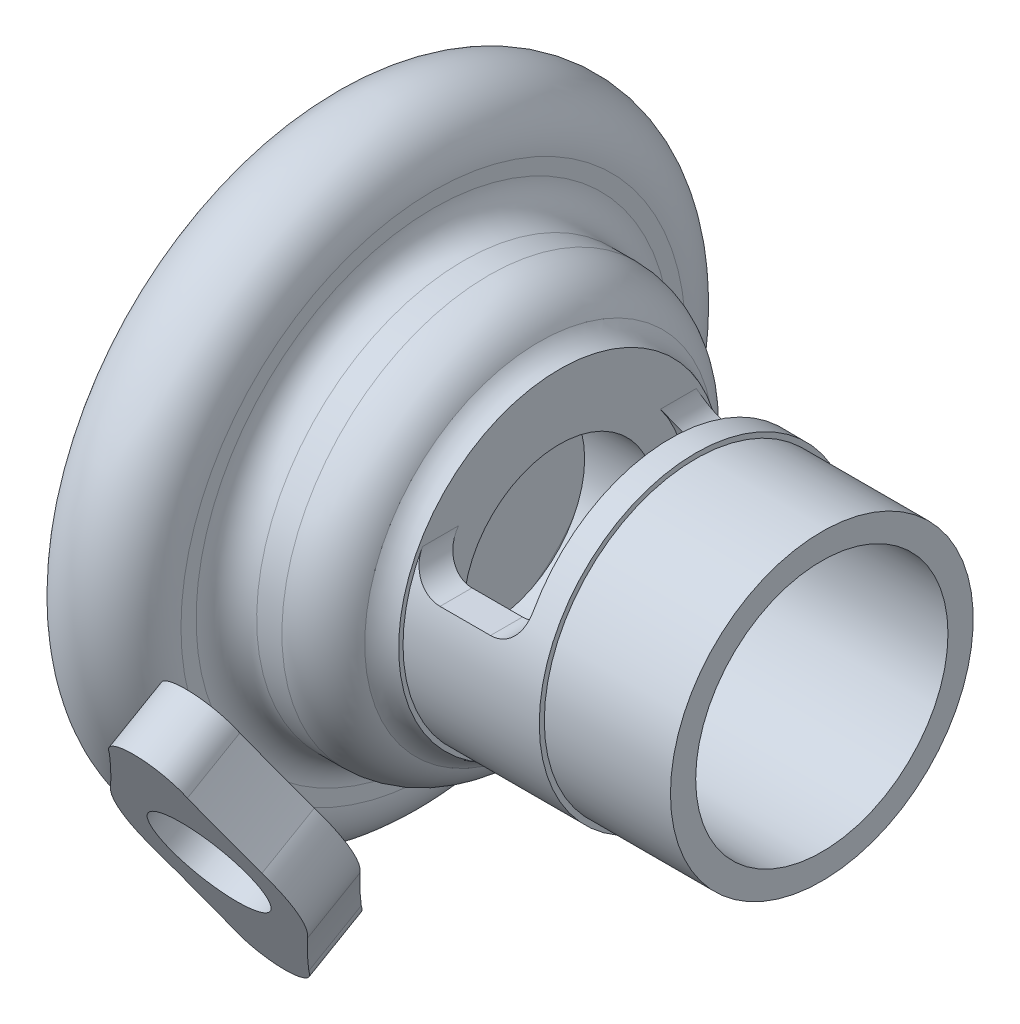
from build123d import *

# Parameters (mm, degrees)
SKETCH3_R               = 31
SKETCH3_R_2             = 25
BOSS_EXTRUDE1_DEPTH     = 22
CUT_EXTRUDE1_DEPTH      = 66.749524713
CUT_EXTRUDE1_DEPTH_BACK = 66.749524713
SKETCH12_R              = 11
BOSS_EXTRUDE2_DEPTH     = 12
CUT_EXTRUDE2_REACH      = 108.699
SKETCH15_R              = 6


with BuildPart() as part:
    # Sketch1 → Revolve1 (revolve)
    with BuildSketch(Plane.XY):
        Polygon((49, 25), (19, 25), (19, 31), (24, 31), (24, 30), (49, 30), align=None)
    revolve(axis=Axis((-49, 0, 0), (1, 0, 0)))

    # Sketch3 → Boss-Extrude1 (add)
    with BuildSketch(Plane.ZY.offset(-19)):
        Circle(SKETCH3_R)
        Circle(SKETCH3_R_2, mode=Mode.SUBTRACT)
    extrude(amount=BOSS_EXTRUDE1_DEPTH)

    # Sketch4 → Cut-Extrude1 (cut, two sides: drawn at the far end of the back side and taken through both)
    with BuildSketch(Plane.XY.offset(-CUT_EXTRUDE1_DEPTH_BACK)):
        with BuildLine():
            Line((-3, 31), (19, 31))
            Line((19, 31), (19, 15))
            ThreePointArc((19, 15), (17.242640687, 10.757359313), (13, 9))
            Line((13, 9), (3, 9))
            ThreePointArc((3, 9), (-1.242640687, 10.757359313), (-3, 15))
            Line((-3, 15), (-3, 31))
        make_face()
    extrude(amount=CUT_EXTRUDE1_DEPTH + CUT_EXTRUDE1_DEPTH_BACK, mode=Mode.SUBTRACT)

    # Sketch10 → Revolve2 (revolve)
    with BuildSketch(Plane.XY):
        with BuildLine():
            Line((-3, 19), (-3, 31.867711866))
            ThreePointArc((-3, 31.867711866), (-5.24492632, 32.866535949), (-7.001114883, 34.585007788))
            ThreePointArc((-7.001114883, 34.585007788), (-19.346514832, 40.746807346), (-28, 30))
            Line((-28, 30), (-28, 0))
            Line((-28, 0), (-25, 0))
            Line((-25, 0), (-25, 30))
            ThreePointArc((-25, 30), (-11.343145751, 35.656854249), (-17, 22))
            Line((-17, 22), (-17, 19))
            Line((-17, 19), (-3, 19))
        make_face()
    revolve(axis=Axis((49, 0, 0), (-1, 0, 0)))



with BuildPart() as body_2:
    # Sketch12 → Boss-Extrude2 (new body)
    with BuildSketch(Plane(origin=(0, -32, 55.425625842), x_dir=(1, 0, 0), z_dir=(0, -0.5000000000000013, 0.8660254037844379))):
        with BuildLine():
            ThreePointArc((-9.270893516, 24.064197899), (-17, 30), (-24.729106484, 24.064197899))
            ThreePointArc((-24.729106484, 24.064197899), (-28.24985512, 16.494307295), (-31.990055384, 9.030406391))
            ThreePointArc((-31.990055384, 9.030406391), (-34.5, 0), (-31.990055384, -9.030406391))
            ThreePointArc((-31.990055384, -9.030406391), (-28.24985512, -16.494307295), (-24.729106484, -24.064197899))
            ThreePointArc((-24.729106484, -24.064197899), (-17, -30), (-9.270893516, -24.064197899))
            ThreePointArc((-9.270893516, -24.064197899), (-5.75014488, -16.494307295), (-2.009944616, -9.030406391))
            ThreePointArc((-2.009944616, -9.030406391), (0.5, 0), (-2.009944616, 9.030406391))
            ThreePointArc((-2.009944616, 9.030406391), (-5.75014488, 16.494307295), (-9.270893516, 24.064197899))
        make_face()
        with Locations((-17, 0)):
            Circle(SKETCH12_R, mode=Mode.SUBTRACT)
    extrude(amount=-BOSS_EXTRUDE2_DEPTH)


with BuildPart() as part_1:
    add(part.part)

    add(body_2.part)  # Revolve3 merges body 2
    # Sketch14 → Revolve3 (revolve)
    with BuildSketch(Plane.XY):
        with BuildLine():
            Line((-52, 38), (-47, 38))
            Line((-47, 38), (-47, 50))
            ThreePointArc((-47, 50), (-39, 58), (-31, 50))
            Line((-31, 50), (-31, 19))
            Line((-31, 19), (-30, 19))
            ThreePointArc((-30, 19), (-28.585786438, 19.585786438), (-28, 21))
            Line((-28, 21), (-28, 30))
            ThreePointArc((-28, 30), (-24.778174593, 37.778174593), (-17, 41))
            Line((-17, 41), (-22, 41))
            ThreePointArc((-22, 41), (-26.242640687, 42.757359313), (-28, 47))
            Line((-28, 47), (-28, 50))
            ThreePointArc((-28, 50), (-38.338804451, 60.98011022), (-49.920512808, 51.32))
            ThreePointArc((-49.920512808, 51.32), (-50.414686209, 50.377502784), (-51.409673646, 50))
            Line((-51.409673646, 50), (-52, 50))
            Line((-52, 50), (-52, 38))
        make_face()
    revolve(axis=Axis((-28, 0, 0), (-1, 0, 0)))

    # Sketch15 → Cut-Extrude2 (cut, up to next)
    with BuildSketch(Plane(origin=(0, 0, 0), x_dir=(1, 0, 0), z_dir=(0, 1, 0)), mode=Mode.PRIVATE) as cut_extrude2_sk1:
        with Locations((8, 0)):
            Circle(SKETCH15_R)
    cut_extrude2_tool1 = extrude(cut_extrude2_sk1.sketch, amount=-CUT_EXTRUDE2_REACH, mode=Mode.PRIVATE) & part_1.part
    add(cut_extrude2_tool1.solids().sort_by_distance((8, 0, 0))[0], mode=Mode.SUBTRACT)


solid = part_1.part
